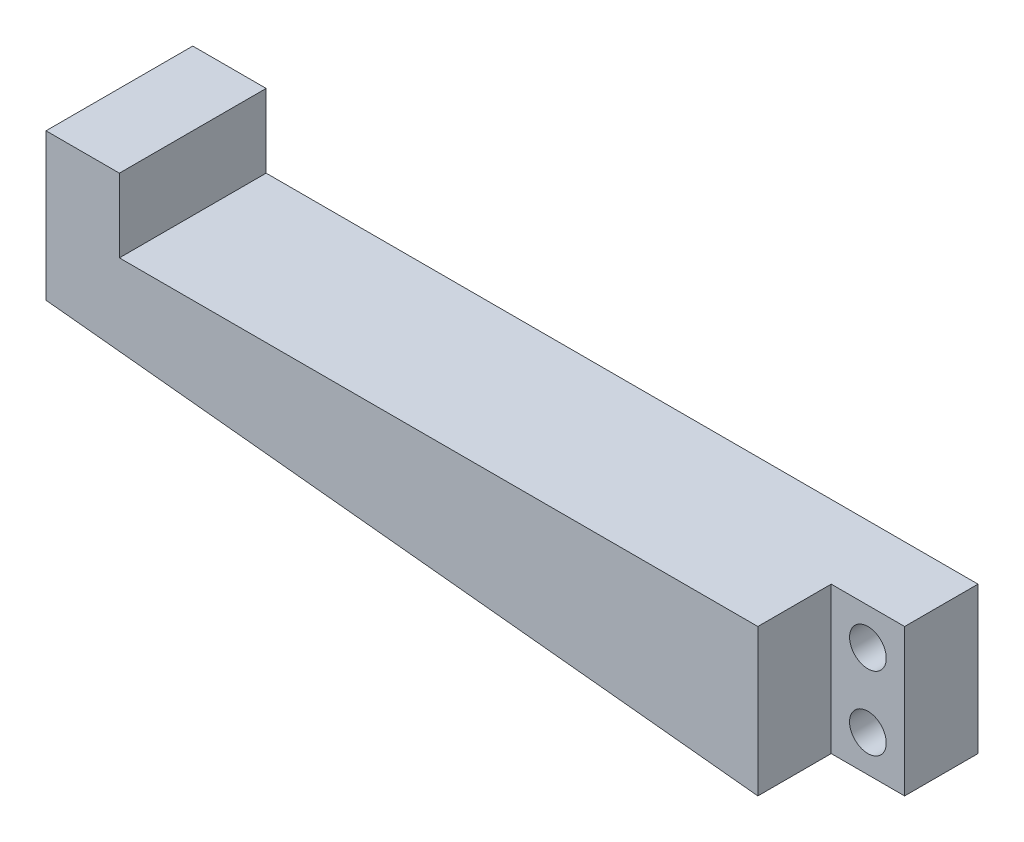
from build123d import *

# Parameters (mm, degrees)
ESQUISSE1_R             = 2.5
BOSS_EXTRU_1_DEPTH      = 20
ESQUISSE2_W             = 10
ESQUISSE2_H             = 20
ENL_V_MAT_EXTRU_1_DEPTH = 10


with BuildPart() as part:
    # Esquisse1 → Boss.-Extru.1 (new body)
    with BuildSketch(Plane.XY):
        Polygon((-102, 0), (-5, -10), (5, -10), (5, 10), (-5, 10), (-92, 10), (-92, 20), (-102, 20), (-102, 10), align=None)
        with Locations((0, 5)):
            Circle(ESQUISSE1_R, mode=Mode.SUBTRACT)
        with Locations((0, -5)):
            Circle(ESQUISSE1_R, mode=Mode.SUBTRACT)
    extrude(amount=BOSS_EXTRU_1_DEPTH)

    # Esquisse2 → Enlèv. mat.-Extru.1 (cut)
    with BuildSketch(Plane.XY.offset(20)):
        Rectangle(ESQUISSE2_W, ESQUISSE2_H)
    extrude(amount=-ENL_V_MAT_EXTRU_1_DEPTH, mode=Mode.SUBTRACT)


solid = part.part
